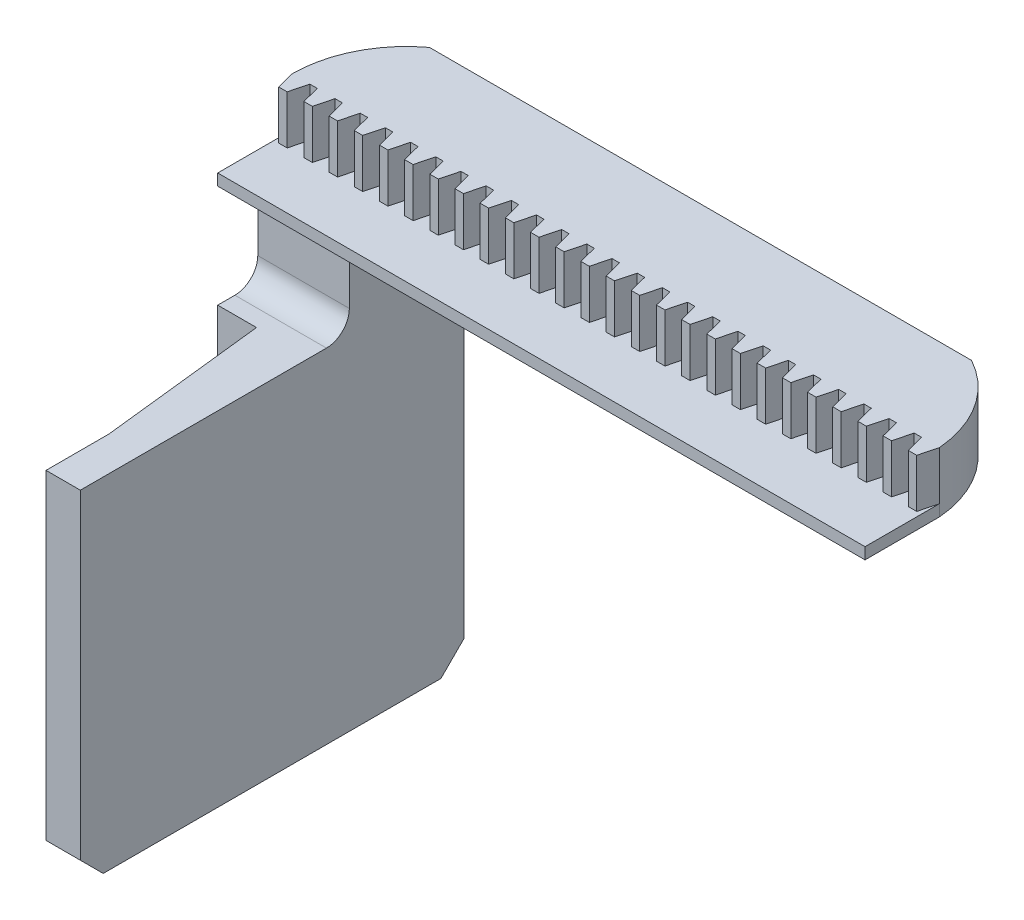
from build123d import *

# Parameters (mm, degrees)
BOSS_EXTRUDE1_DEPTH = 4.25
BOSS_EXTRUDE2_START = -1
BOSS_EXTRUDE2_DEPTH = 1
BOSS_EXTRUDE3_DEPTH = 8
CUT_EXTRUDE2_DEPTH  = 63.822057505
CUT_EXTRUDE4_START  = -39.000000805
CUT_EXTRUDE4_DEPTH  = 38.707889695
BOSS_EXTRUDE5_START = -1
BOSS_EXTRUDE5_DEPTH = 1
BOSS_EXTRUDE6_DEPTH = 4.25
FILLET1_R           = 2


# Read off the part's stored shape, not the designer's step: Cut-Extrude4
with BuildPart() as part:
    # Sketch1 → Boss-Extrude1 (new body)
    with BuildSketch(Plane(origin=(0, 0, 0), x_dir=(1, 0, 0), z_dir=(0, 1, 0))):
        with BuildLine():
            Line((33.597981706, -8.253844427), (34.005304366, -6.678843843))
            ThreePointArc((34.005304366, -6.678843843), (32.949576248, -2.206707665), (30.005304176, 1.321156537))
            Line((30.005304176, 1.321156537), (-5.346833689, 1.321156537))
            ThreePointArc((-5.346833689, 1.321156537), (-8.291105761, -2.206707665), (-9.346833879, -6.678843843))
            Line((-9.346833879, -6.678843843), (-8.939511162, -8.253844427))
            Line((-8.939511162, -8.253844427), (-8.202018294, -8.253844427))
            Line((-8.202018294, -8.253844427), (-7.794695634, -6.678843843))
            Line((-7.794695634, -6.678843843), (-7.146833879, -6.678843843))
            Line((-7.146833879, -6.678843843), (-6.739511162, -8.253844427))
            Line((-6.739511162, -8.253844427), (-6.002018294, -8.253844427))
            Line((-6.002018294, -8.253844427), (-5.594695634, -6.678843843))
            Line((-5.594695634, -6.678843843), (-4.946833879, -6.678843843))
            Line((-4.946833879, -6.678843843), (-4.539511162, -8.253844427))
            Line((-4.539511162, -8.253844427), (-3.802018294, -8.253844427))
            Line((-3.802018294, -8.253844427), (-3.394695634, -6.678843843))
            Line((-3.394695634, -6.678843843), (-2.746833879, -6.678843843))
            Line((-2.746833879, -6.678843843), (-2.339511162, -8.253844427))
            Line((-2.339511162, -8.253844427), (-1.602018294, -8.253844427))
            Line((-1.602018294, -8.253844427), (-1.194695634, -6.678843843))
            Line((-1.194695634, -6.678843843), (-0.546833879, -6.678843843))
            Line((-0.546833879, -6.678843843), (-0.139511162, -8.253844427))
            Line((-0.139511162, -8.253844427), (0.597981706, -8.253844427))
            Line((0.597981706, -8.253844427), (1.005304366, -6.678843843))
            Line((1.005304366, -6.678843843), (1.653166121, -6.678843843))
            Line((1.653166121, -6.678843843), (2.060488838, -8.253844427))
            Line((2.060488838, -8.253844427), (2.797981706, -8.253844427))
            Line((2.797981706, -8.253844427), (3.205304366, -6.678843843))
            Line((3.205304366, -6.678843843), (3.853166121, -6.678843843))
            Line((3.853166121, -6.678843843), (4.260488838, -8.253844427))
            Line((4.260488838, -8.253844427), (4.997981706, -8.253844427))
            Line((4.997981706, -8.253844427), (5.405304366, -6.678843843))
            Line((5.405304366, -6.678843843), (6.053166121, -6.678843843))
            Line((6.053166121, -6.678843843), (6.460488838, -8.253844427))
            Line((6.460488838, -8.253844427), (7.197981706, -8.253844427))
            Line((7.197981706, -8.253844427), (7.605304366, -6.678843843))
            Line((7.605304366, -6.678843843), (8.253166121, -6.678843843))
            Line((8.253166121, -6.678843843), (8.660488838, -8.253844427))
            Line((8.660488838, -8.253844427), (9.397981706, -8.253844427))
            Line((9.397981706, -8.253844427), (9.805304366, -6.678843843))
            Line((9.805304366, -6.678843843), (10.453166121, -6.678843843))
            Line((10.453166121, -6.678843843), (10.860488838, -8.253844427))
            Line((10.860488838, -8.253844427), (11.597981706, -8.253844427))
            Line((11.597981706, -8.253844427), (12.005304366, -6.678843843))
            Line((12.005304366, -6.678843843), (12.653166121, -6.678843843))
            Line((12.653166121, -6.678843843), (13.060488838, -8.253844427))
            Line((13.060488838, -8.253844427), (13.797981706, -8.253844427))
            Line((13.797981706, -8.253844427), (14.205304366, -6.678843843))
            Line((14.205304366, -6.678843843), (14.853166121, -6.678843843))
            Line((14.853166121, -6.678843843), (15.260488838, -8.253844427))
            Line((15.260488838, -8.253844427), (15.997981706, -8.253844427))
            Line((15.997981706, -8.253844427), (16.405304366, -6.678843843))
            Line((16.405304366, -6.678843843), (17.053166121, -6.678843843))
            Line((17.053166121, -6.678843843), (17.460488838, -8.253844427))
            Line((17.460488838, -8.253844427), (18.197981706, -8.253844427))
            Line((18.197981706, -8.253844427), (18.605304366, -6.678843843))
            Line((18.605304366, -6.678843843), (19.253166121, -6.678843843))
            Line((19.253166121, -6.678843843), (19.660488838, -8.253844427))
            Line((19.660488838, -8.253844427), (20.397981706, -8.253844427))
            Line((20.397981706, -8.253844427), (20.805304366, -6.678843843))
            Line((20.805304366, -6.678843843), (21.453166121, -6.678843843))
            Line((21.453166121, -6.678843843), (21.860488838, -8.253844427))
            Line((21.860488838, -8.253844427), (22.597981706, -8.253844427))
            Line((22.597981706, -8.253844427), (23.005304366, -6.678843843))
            Line((23.005304366, -6.678843843), (23.653166121, -6.678843843))
            Line((23.653166121, -6.678843843), (24.060488838, -8.253844427))
            Line((24.060488838, -8.253844427), (24.797981706, -8.253844427))
            Line((24.797981706, -8.253844427), (25.205304366, -6.678843843))
            Line((25.205304366, -6.678843843), (25.853166121, -6.678843843))
            Line((25.853166121, -6.678843843), (26.260488838, -8.253844427))
            Line((26.260488838, -8.253844427), (26.997981706, -8.253844427))
            Line((26.997981706, -8.253844427), (27.405304366, -6.678843843))
            Line((27.405304366, -6.678843843), (28.053166121, -6.678843843))
            Line((28.053166121, -6.678843843), (28.460488838, -8.253844427))
            Line((28.460488838, -8.253844427), (29.197981706, -8.253844427))
            Line((29.197981706, -8.253844427), (29.605304366, -6.678843843))
            Line((29.605304366, -6.678843843), (30.253166121, -6.678843843))
            Line((30.253166121, -6.678843843), (30.660488838, -8.253844427))
            Line((30.660488838, -8.253844427), (31.397981706, -8.253844427))
            Line((31.397981706, -8.253844427), (31.805304366, -6.678843843))
            Line((31.805304366, -6.678843843), (32.453166121, -6.678843843))
            Line((32.453166121, -6.678843843), (32.860488838, -8.253844427))
            Line((32.860488838, -8.253844427), (33.597981706, -8.253844427))
        make_face()
    extrude(amount=BOSS_EXTRUDE1_DEPTH)

    # Sketch1<3> → Boss-Extrude2 (add)
    with BuildSketch(Plane(origin=(0, 0, 0), x_dir=(1, 0, 0), z_dir=(0, 1, 0)).offset(BOSS_EXTRUDE2_START)):
        with BuildLine():
            Line((34.005304366, -6.678843843), (34.005304366, -13.178843977))
            Line((34.005304366, -13.178843977), (-9.346833879, -13.178843977))
            Line((-9.346833879, -13.178843977), (-9.346833879, -6.678843843))
            ThreePointArc((-9.346833879, -6.678843843), (-8.291105761, -2.206707665), (-5.346833689, 1.321156537))
            Line((-5.346833689, 1.321156537), (30.005304176, 1.321156537))
            ThreePointArc((30.005304176, 1.321156537), (32.949576248, -2.206707665), (34.005304366, -6.678843843))
        make_face()
    extrude(amount=BOSS_EXTRUDE2_DEPTH)

    # Sketch2 → Boss-Extrude3 (add)
    with BuildSketch(Plane.ZY.offset(9.346833879)):
        with BuildLine():
            Line((-0.321155635, -9.999999776), (-0.321155635, -38.000000477))
            Line((-0.321155635, -38.000000477), (1.678844693, -40.000000805))
            Line((1.678844693, -40.000000805), (31.178844871, -40.000000805))
            Line((31.178844871, -40.000000805), (33.178845199, -38.000000477))
            Line((33.178845199, -38.000000477), (33.178845199, -9.999999613))
            Line((33.178845199, -9.999999613), (11.678843977, -9.999999613))
            ThreePointArc((11.678843977, -9.999999613), (10.264630415, -9.414213175), (9.678843977, -7.999999613))
            Line((9.678843977, -7.999999613), (9.678843977, -1))
            Line((9.678843977, -1), (6.678843843, -1))
            Line((6.678843843, -1), (1.678844529, -1))
            Line((1.678844529, -1), (1.678844529, -7.999999613))
            ThreePointArc((1.678844529, -7.999999613), (1.093058043, -9.414213291), (-0.321155635, -9.999999776))
        make_face()
    extrude(amount=-BOSS_EXTRUDE3_DEPTH)

    # Sketch3 → Cut-Extrude2 (cut, through all)
    with BuildSketch(Plane.XY.offset(33.178845199)):
        with BuildLine():
            ThreePointArc((-2.346834043, -40.000000805), (-7.296219092, -37.949386296), (-9.346834259, -33.00000152))
            Line((-9.346834259, -33.00000152), (-9.346834259, -40.000000805))
            Line((-9.346834259, -40.000000805), (-2.346834043, -40.000000805))
        make_face()
    extrude(amount=-CUT_EXTRUDE2_DEPTH, mode=Mode.SUBTRACT)

    # Cut-Extrude4 outline → Cut-Extrude4 (cut)
    with BuildSketch(Plane.XZ.offset(40.000000805).offset(CUT_EXTRUDE4_START)):
        with BuildLine():
            ThreePointArc((-6.346834233, 1.678844693), (-8.286187836, 2.849531896), (-9.346844813, 4.85118314))
            Line((-9.346844813, 4.85118314), (-9.346833879, 1.678844529))
            Line((-9.346833879, 1.678844529), (-6.346834233, 1.678844693))
        make_face()
        Polygon((-9.346834259, 13.178845646), (-5.957945227, 13.178845646), (-4.346834371, 27.678845229), (-4.346834371, 33.178845199), (-9.346833879, 33.178845199), align=None)
        Polygon((-4.346834371, -0.321155635), (-6.346834233, 1.678844693), (-9.346833879, 1.678844529), (-9.346833879, -0.321155635), align=None)
    extrude(amount=CUT_EXTRUDE4_DEPTH, mode=Mode.SUBTRACT)

    # Sketch5 → Boss-Extrude5 (add)
    with BuildSketch(Plane(origin=(0, 0, 0), x_dir=(1, 0, 0), z_dir=(0, 1, 0)).offset(BOSS_EXTRUDE5_START)):
        with BuildLine():
            Line((47.205304366, -6.678843843), (46.797981706, -8.253844427))
            Line((46.797981706, -8.253844427), (46.060488838, -8.253844427))
            Line((46.060488838, -8.253844427), (45.653166121, -6.678843843))
            Line((45.653166121, -6.678843843), (45.005304366, -6.678843843))
            Line((45.005304366, -6.678843843), (44.597981706, -8.253844427))
            Line((44.597981706, -8.253844427), (43.860488838, -8.253844427))
            Line((43.860488838, -8.253844427), (43.453166121, -6.678843843))
            Line((43.453166121, -6.678843843), (42.805304366, -6.678843843))
            Line((42.805304366, -6.678843843), (42.397981706, -8.253844427))
            Line((42.397981706, -8.253844427), (41.660488838, -8.253844427))
            Line((41.660488838, -8.253844427), (41.253166121, -6.678843843))
            Line((41.253166121, -6.678843843), (40.605304366, -6.678843843))
            Line((40.605304366, -6.678843843), (40.197981706, -8.253844427))
            Line((40.197981706, -8.253844427), (39.460488838, -8.253844427))
            Line((39.460488838, -8.253844427), (39.053166121, -6.678843843))
            Line((39.053166121, -6.678843843), (38.405304366, -6.678843843))
            Line((38.405304366, -6.678843843), (37.997981706, -8.253844427))
            Line((37.997981706, -8.253844427), (37.260488838, -8.253844427))
            Line((37.260488838, -8.253844427), (36.853166121, -6.678843843))
            Line((36.853166121, -6.678843843), (36.205304366, -6.678843843))
            Line((36.205304366, -6.678843843), (35.797981706, -8.253844427))
            Line((35.797981706, -8.253844427), (35.060488838, -8.253844427))
            Line((35.060488838, -8.253844427), (34.653166121, -6.678843843))
            Line((34.653166121, -6.678843843), (34.005304366, -6.678843843))
            ThreePointArc((34.005304366, -6.678843843), (32.949576248, -2.206707665), (30.005304176, 1.321156537))
            Line((30.005304176, 1.321156537), (42.005304176, 1.321156537))
            ThreePointArc((42.005304176, 1.321156537), (45.620970607, -2.018660542), (47.205304366, -6.678843843))
        make_face()
        Polygon((45.005304366, -6.678843843), (45.653166121, -6.678843843), (46.060488838, -8.253844427), (46.797981706, -8.253844427), (47.205304366, -6.678843843), (47.205304366, -13.178843977), (34.005304366, -13.178843977), (34.005304366, -6.678843843), (34.653166121, -6.678843843), (35.060488838, -8.253844427), (35.797981706, -8.253844427), (36.205304366, -6.678843843), (36.853166121, -6.678843843), (37.260488838, -8.253844427), (37.997981706, -8.253844427), (38.405304366, -6.678843843), (39.053166121, -6.678843843), (39.460488838, -8.253844427), (40.197981706, -8.253844427), (40.605304366, -6.678843843), (41.253166121, -6.678843843), (41.660488838, -8.253844427), (42.397981706, -8.253844427), (42.805304366, -6.678843843), (43.453166121, -6.678843843), (43.860488838, -8.253844427), (44.597981706, -8.253844427), align=None)
    extrude(amount=BOSS_EXTRUDE5_DEPTH)

    # Sketch5<3> → Boss-Extrude6 (add)
    with BuildSketch(Plane(origin=(0, 0, 0), x_dir=(1, 0, 0), z_dir=(0, 1, 0))):
        with BuildLine():
            Line((47.205304366, -6.678843843), (46.797981706, -8.253844427))
            Line((46.797981706, -8.253844427), (46.060488838, -8.253844427))
            Line((46.060488838, -8.253844427), (45.653166121, -6.678843843))
            Line((45.653166121, -6.678843843), (45.005304366, -6.678843843))
            Line((45.005304366, -6.678843843), (44.597981706, -8.253844427))
            Line((44.597981706, -8.253844427), (43.860488838, -8.253844427))
            Line((43.860488838, -8.253844427), (43.453166121, -6.678843843))
            Line((43.453166121, -6.678843843), (42.805304366, -6.678843843))
            Line((42.805304366, -6.678843843), (42.397981706, -8.253844427))
            Line((42.397981706, -8.253844427), (41.660488838, -8.253844427))
            Line((41.660488838, -8.253844427), (41.253166121, -6.678843843))
            Line((41.253166121, -6.678843843), (40.605304366, -6.678843843))
            Line((40.605304366, -6.678843843), (40.197981706, -8.253844427))
            Line((40.197981706, -8.253844427), (39.460488838, -8.253844427))
            Line((39.460488838, -8.253844427), (39.053166121, -6.678843843))
            Line((39.053166121, -6.678843843), (38.405304366, -6.678843843))
            Line((38.405304366, -6.678843843), (37.997981706, -8.253844427))
            Line((37.997981706, -8.253844427), (37.260488838, -8.253844427))
            Line((37.260488838, -8.253844427), (36.853166121, -6.678843843))
            Line((36.853166121, -6.678843843), (36.205304366, -6.678843843))
            Line((36.205304366, -6.678843843), (35.797981706, -8.253844427))
            Line((35.797981706, -8.253844427), (35.060488838, -8.253844427))
            Line((35.060488838, -8.253844427), (34.653166121, -6.678843843))
            Line((34.653166121, -6.678843843), (34.005304366, -6.678843843))
            ThreePointArc((34.005304366, -6.678843843), (32.949576248, -2.206707665), (30.005304176, 1.321156537))
            Line((30.005304176, 1.321156537), (42.005304176, 1.321156537))
            ThreePointArc((42.005304176, 1.321156537), (45.620970607, -2.018660542), (47.205304366, -6.678843843))
        make_face()
    extrude(amount=BOSS_EXTRUDE6_DEPTH)

    # Fillet1
    fillet1_edges = [part.edges().sort_by_distance(p)[0] for p in [
        (-1.346833879, -1, 5.678844253),
    ]]
    fillet(fillet1_edges, radius=FILLET1_R)


solid = part.part
